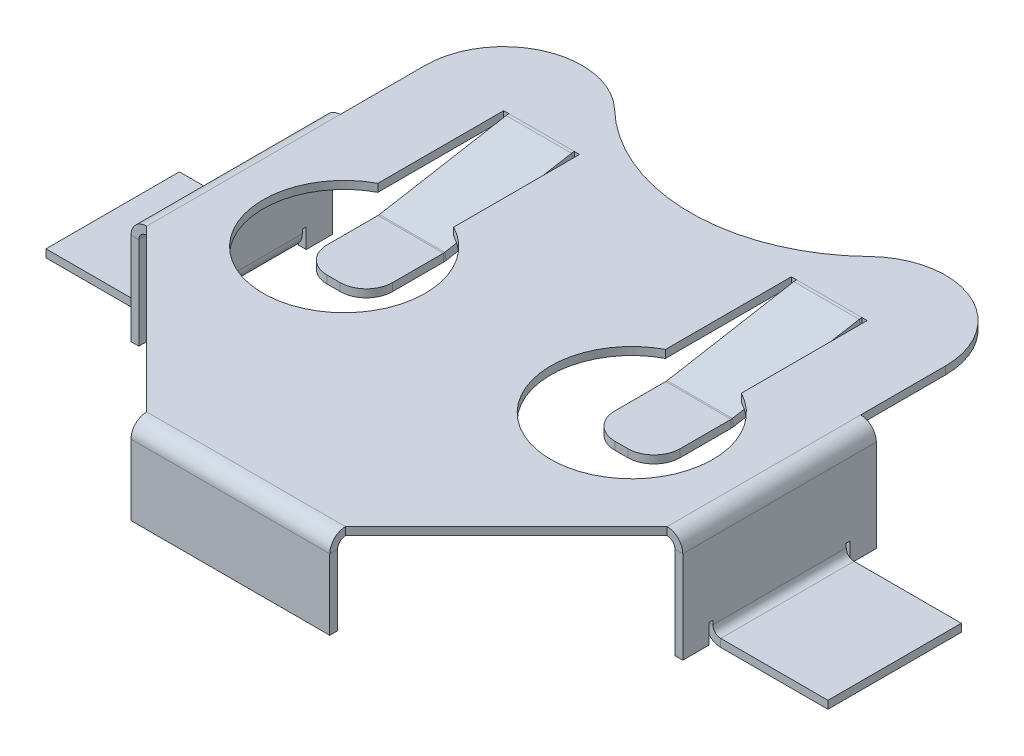
from build123d import *

# Parameters (mm, degrees)
BASE_FLANGE1_DEPTH              = 0.3
EDGE_FLANGE2_DEPTH              = 7.6
EDGE_FLANGE3_DEPTH              = 7.4
EDGE_FLANGE3_BEND_DEPTH         = 7.4
EDGE_FLANGE9_STRIP_W            = 1.8
EDGE_FLANGE9_STRIP_H            = 0.3
EDGE_FLANGE9_STRIP_CUT_DEPTH    = 5.1
EDGE_FLANGE9_RELIEF_W           = 1.95
EDGE_FLANGE9_RELIEF_H           = 0.15
EDGE_FLANGE9_RELIEF_CUT_DEPTH   = 0.3
EDGE_FLANGE9_STRIP_2_W          = 1.8
EDGE_FLANGE9_STRIP_2_H          = 0.3
EDGE_FLANGE9_STRIP_CUT_2_DEPTH  = 5.1
EDGE_FLANGE9_RELIEF_2_W         = 1.95
EDGE_FLANGE9_RELIEF_2_H         = 0.15
EDGE_FLANGE9_RELIEF_CUT_2_DEPTH = 0.3
EDGE_FLANGE9_DEPTH              = 5.1
EDGE_FLANGE9_BEND_DEPTH         = 5.1
SKETCH164_R                     = 3.1
CUT_EXTRUDE1_DEPTH              = 10
CUT_EXTRUDE2_DEPTH              = 26.150701614
CUT_EXTRUDE2_DEPTH_BACK         = 26.150701614
SKETCH228_W                     = 2.9
SKETCH228_H                     = 7.24828594
EDGE_FLANGE10_DEPTH             = 2.5
EDGE_FLANGE10_BEND_DEPTH        = 2.5
EDGE_FLANGE11_STRIP_CUT_DEPTH   = 2.5
EDGE_FLANGE11_STRIP_CUT_2_DEPTH = 2.5
EDGE_FLANGE11_DEPTH             = 2.5
EDGE_FLANGE11_BEND_DEPTH        = 2.5
BREAK_CORNER1_START             = -1.168240888
BREAK_CORNER1_DEPTH             = 0.3


# Read off the part's stored shape, not the designer's step: Break-Corner1
# Sheet-metal steps are written as plain solids
with BuildPart() as part:
    # Sketch1 → Base-Flange1 (new body)
    with BuildSketch(Plane(origin=(0, 0, 0), x_dir=(1, 0, 0), z_dir=(0, 1, 0))):
        with BuildLine():
            Line((-3.8, 0), (3.8, 0))
            Line((3.8, 0), (9.95, 6.15))
            Line((9.95, 6.15), (9.95, 16.8))
            ThreePointArc((9.95, 16.8), (8.121537451, 19.561792896), (4.865, 18.957029207))
            ThreePointArc((4.865, 18.957029207), (0, 16.990097357), (-4.865, 18.957029207))
            ThreePointArc((-4.865, 18.957029207), (-8.121537451, 19.561792896), (-9.95, 16.8))
            Line((-9.95, 16.8), (-9.95, 6.15))
            Line((-9.95, 6.15), (-3.8, 0))
        make_face()
    extrude(amount=-BASE_FLANGE1_DEPTH)

    # Edge-Flange2 section (across the edge) → Edge-Flange2 (add)
    with BuildSketch(Plane(origin=(3.8, -0.3, 0.3), x_dir=(0, 0, -1), z_dir=(-1, 0, 0))):
        with BuildLine():
            Line((-0.3, 0.3), (-0.3, 3))
            Line((-0.3, 3), (0, 3))
            Line((0, 3), (0, 0.3))
            ThreePointArc((0, 0.3), (0.087867966, 0.087867966), (0.3, 0))
            Line((0.3, 0), (0.3, -0.3))
            ThreePointArc((0.3, -0.3), (-0.124264069, -0.124264069), (-0.3, 0.3))
        make_face()
    extrude(amount=EDGE_FLANGE2_DEPTH)

    # Edge-Flange3 section (across the edge) → Edge-Flange3 (add)
    with BuildSketch(Plane(origin=(10.25, -0.3, -13.55), x_dir=(-1, 0, 0), z_dir=(0, 0, 1))):
        with BuildLine():
            Line((-0.3, 0.3), (-0.3, 3.8249596))
            Line((-0.3, 3.8249596), (0, 3.8249596))
            Line((0, 3.8249596), (0, 0.3))
            ThreePointArc((0, 0.3), (0.087867966, 0.087867966), (0.3, 0))
            Line((0.3, 0), (0.3, -0.3))
            ThreePointArc((0.3, -0.3), (-0.124264069, -0.124264069), (-0.3, 0.3))
        make_face()
    extrude(amount=EDGE_FLANGE3_DEPTH)

    # Edge-Flange3 section 2 (across the edge) → Edge-Flange3 bend (add)
    with BuildSketch(Plane(origin=(-10.25, -0.3, -6.15), x_dir=(1, 0, 0), z_dir=(0, 0, -1))):
        with BuildLine():
            Line((-0.3, 0.3), (-0.3, 3.8249596))
            Line((-0.3, 3.8249596), (0, 3.8249596))
            Line((0, 3.8249596), (0, 0.3))
            ThreePointArc((0, 0.3), (0.087867966, 0.087867966), (0.3, 0))
            Line((0.3, 0), (0.3, -0.3))
            ThreePointArc((0.3, -0.3), (-0.124264069, -0.124264069), (-0.3, 0.3))
        make_face()
    extrude(amount=EDGE_FLANGE3_BEND_DEPTH)

    # Edge-Flange9 strip (across the edge) → Edge-Flange9 strip cut (cut)
    with BuildSketch(Plane(origin=(-10.55, -4.1249596, -12.4), x_dir=(0, 1, 0), z_dir=(0, 0, 1))):
        with Locations((-0.3, -0.15)):
            Rectangle(EDGE_FLANGE9_STRIP_W, EDGE_FLANGE9_STRIP_H)
    extrude(amount=EDGE_FLANGE9_STRIP_CUT_DEPTH, mode=Mode.SUBTRACT)

    # Edge-Flange9 relief (on the sheet) → Edge-Flange9 relief cut (cut)
    with BuildSketch(Plane(origin=(-10.55, -3.5249596, -12.4), x_dir=(0, 1, 0), z_dir=(-1, 0, 0))):
        with Locations((-0.825, 0.075)):
            Rectangle(EDGE_FLANGE9_RELIEF_W, EDGE_FLANGE9_RELIEF_H)
        with Locations((-0.825, -5.175)):
            Rectangle(EDGE_FLANGE9_RELIEF_W, EDGE_FLANGE9_RELIEF_H)
    extrude(amount=-EDGE_FLANGE9_RELIEF_CUT_DEPTH, mode=Mode.SUBTRACT)

    # Edge-Flange9 strip 2 (across the edge) → Edge-Flange9 strip cut 2 (cut)
    with BuildSketch(Plane(origin=(10.55, -4.1249596, -7.3), x_dir=(0, 1, 0), z_dir=(0, 0, -1))):
        with Locations((-0.3, -0.15)):
            Rectangle(EDGE_FLANGE9_STRIP_2_W, EDGE_FLANGE9_STRIP_2_H)
    extrude(amount=EDGE_FLANGE9_STRIP_CUT_2_DEPTH, mode=Mode.SUBTRACT)

    # Edge-Flange9 relief 2 (on the sheet) → Edge-Flange9 relief cut 2 (cut)
    with BuildSketch(Plane(origin=(10.55, -3.5249596, -7.3), x_dir=(0, 1, 0), z_dir=(1, 0, 0))):
        with Locations((-0.825, 0.075)):
            Rectangle(EDGE_FLANGE9_RELIEF_2_W, EDGE_FLANGE9_RELIEF_2_H)
        with Locations((-0.825, -5.175)):
            Rectangle(EDGE_FLANGE9_RELIEF_2_W, EDGE_FLANGE9_RELIEF_2_H)
    extrude(amount=-EDGE_FLANGE9_RELIEF_CUT_2_DEPTH, mode=Mode.SUBTRACT)

    # Edge-Flange9 section (across the edge) → Edge-Flange9 (add)
    with BuildSketch(Plane(origin=(-10.55, -4.1249596, -12.4), x_dir=(0, 1, 0), z_dir=(0, 0, 1))):
        with BuildLine():
            Line((0, 0.3), (0, 4.4))
            Line((0, 4.4), (0.3, 4.4))
            Line((0.3, 4.4), (0.3, 0.3))
            ThreePointArc((0.3, 0.3), (0.387867966, 0.087867966), (0.6, 0))
            Line((0.6, 0), (0.6, -0.3))
            ThreePointArc((0.6, -0.3), (0.175735931, -0.124264069), (0, 0.3))
        make_face()
    extrude(amount=EDGE_FLANGE9_DEPTH)

    # Edge-Flange9 section 2 (across the edge) → Edge-Flange9 bend (add)
    with BuildSketch(Plane(origin=(10.55, -4.1249596, -7.3), x_dir=(0, 1, 0), z_dir=(0, 0, -1))):
        with BuildLine():
            Line((0, 0.3), (0, 4.4))
            Line((0, 4.4), (0.3, 4.4))
            Line((0.3, 4.4), (0.3, 0.3))
            ThreePointArc((0.3, 0.3), (0.387867966, 0.087867966), (0.6, 0))
            Line((0.6, 0), (0.6, -0.3))
            ThreePointArc((0.6, -0.3), (0.175735931, -0.124264069), (0, 0.3))
        make_face()
    extrude(amount=EDGE_FLANGE9_BEND_DEPTH)

    # Sketch164 → Cut-Extrude1 (cut)
    with BuildSketch(Plane(origin=(0, 0, 0), x_dir=(1, 0, 0), z_dir=(0, 1, 0))):
        with Locations(Location((-5.5, 9.25, 0), (0, 0, 270))):
            Circle(SKETCH164_R)
        with Locations(Location((5.5, 9.25, 0), (0, 0, 270))):
            Circle(SKETCH164_R)
    extrude(amount=-CUT_EXTRUDE1_DEPTH, mode=Mode.SUBTRACT)

    # Sketch228 → Cut-Extrude2 (cut, two sides: drawn at the far end of the back side and taken through both)
    with BuildSketch(Plane(origin=(0, 0, 0), x_dir=(1, 0, 0), z_dir=(0, 1, 0)).offset(-CUT_EXTRUDE2_DEPTH_BACK)):
        with Locations((-5.5, 13.17585703)):
            Rectangle(SKETCH228_W, SKETCH228_H)
        with Locations((5.5, 13.17585703)):
            Rectangle(SKETCH228_W, SKETCH228_H)
    extrude(amount=CUT_EXTRUDE2_DEPTH + CUT_EXTRUDE2_DEPTH_BACK, mode=Mode.SUBTRACT)

    # Edge-Flange10 section (across the edge) → Edge-Flange10 (add)
    with BuildSketch(Plane(origin=(-4.25, -0.3, -16.773753401), x_dir=(0, -0.9848077530122092, -0.1736481776669237), z_dir=(-1, 0, 0))):
        with BuildLine():
            Line((-0.3, 0.026246599), (-0.3, 4.973753401))
            Line((-0.3, 4.973753401), (0, 4.973753401))
            Line((0, 4.973753401), (0, 0.026246599))
            ThreePointArc((0, 0.026246599), (0.001141591, 9.9876e-05), (0.004557674, -0.025847854))
            Line((0.004557674, -0.025847854), (-0.290884652, -0.077942308))
            ThreePointArc((-0.290884652, -0.077942308), (-0.297716819, -0.026046847), (-0.3, 0.026246599))
        make_face()
    extrude(amount=EDGE_FLANGE10_DEPTH)

    # Edge-Flange10 section 2 (across the edge) → Edge-Flange10 bend (add)
    with BuildSketch(Plane(origin=(6.75, -0.3, -16.773753401), x_dir=(0, -0.9848077530122092, -0.1736481776669237), z_dir=(-1, 0, 0))):
        with BuildLine():
            Line((-0.3, 0.026246599), (-0.3, 4.973753401))
            Line((-0.3, 4.973753401), (0, 4.973753401))
            Line((0, 4.973753401), (0, 0.026246599))
            ThreePointArc((0, 0.026246599), (0.001141591, 9.9876e-05), (0.004557674, -0.025847854))
            Line((0.004557674, -0.025847854), (-0.290884652, -0.077942308))
            ThreePointArc((-0.290884652, -0.077942308), (-0.297716819, -0.026046847), (-0.3, 0.026246599))
        make_face()
    extrude(amount=EDGE_FLANGE10_BEND_DEPTH)

    # Edge-Flange11 strip (across the edge) → Edge-Flange11 strip cut (cut)
    with BuildSketch(Plane(origin=(-6.75, -0.868240888, -11.823468037), x_dir=(0, 1, 0), z_dir=(1, 0, 0))):
        Polygon((-0.603451372, 1.694711648), (-0.290884652, -0.077942308), (0.004557674, -0.025847854), (-0.308009046, 1.746806101), align=None)
    extrude(amount=EDGE_FLANGE11_STRIP_CUT_DEPTH, mode=Mode.SUBTRACT)

    # Edge-Flange11 strip 2 (across the edge) → Edge-Flange11 strip cut 2 (cut)
    with BuildSketch(Plane(origin=(4.25, -0.868240888, -11.823468037), x_dir=(0, 1, 0), z_dir=(1, 0, 0))):
        Polygon((-0.603451372, 1.694711648), (-0.290884652, -0.077942308), (0.004557674, -0.025847854), (-0.308009046, 1.746806101), align=None)
    extrude(amount=EDGE_FLANGE11_STRIP_CUT_2_DEPTH, mode=Mode.SUBTRACT)

    # Edge-Flange11 section (across the edge) → Edge-Flange11 (add)
    with BuildSketch(Plane(origin=(-6.75, -0.868240888, -11.823468037), x_dir=(0, 1, 0), z_dir=(1, 0, 0))):
        with BuildLine():
            Line((-0.3, 0.026246599), (-0.3, 2.973753401))
            Line((-0.3, 2.973753401), (0, 2.973753401))
            Line((0, 2.973753401), (0, 0.026246599))
            ThreePointArc((0, 0.026246599), (0.001141591, 9.9876e-05), (0.004557674, -0.025847854))
            Line((0.004557674, -0.025847854), (-0.290884652, -0.077942308))
            ThreePointArc((-0.290884652, -0.077942308), (-0.297716819, -0.026046847), (-0.3, 0.026246599))
        make_face()
    extrude(amount=EDGE_FLANGE11_DEPTH)

    # Edge-Flange11 section 2 (across the edge) → Edge-Flange11 bend (add)
    with BuildSketch(Plane(origin=(4.25, -0.868240888, -11.823468037), x_dir=(0, 1, 0), z_dir=(1, 0, 0))):
        with BuildLine():
            Line((-0.3, 0.026246599), (-0.3, 2.973753401))
            Line((-0.3, 2.973753401), (0, 2.973753401))
            Line((0, 2.973753401), (0, 0.026246599))
            ThreePointArc((0, 0.026246599), (0.001141591, 9.9876e-05), (0.004557674, -0.025847854))
            Line((0.004557674, -0.025847854), (-0.290884652, -0.077942308))
            ThreePointArc((-0.290884652, -0.077942308), (-0.297716819, -0.026046847), (-0.3, 0.026246599))
        make_face()
    extrude(amount=EDGE_FLANGE11_BEND_DEPTH)

    # Break-Corner1 outline → Break-Corner1 (cut)
    with BuildSketch(Plane(origin=(0, 0, 0), x_dir=(1, 0, 0), z_dir=(0, 1, 0)).offset(BREAK_CORNER1_START)):
        with BuildLine():
            ThreePointArc((6.75, 9.849714636), (6.457106781, 9.142607855), (5.75, 8.849714636))
            Line((5.75, 8.849714636), (6.75, 8.849714636))
            Line((6.75, 8.849714636), (6.75, 9.849714636))
        make_face()
        with BuildLine():
            Line((4.25, 8.849714636), (5.25, 8.849714636))
            ThreePointArc((5.25, 8.849714636), (4.542893219, 9.142607855), (4.25, 9.849714636))
            Line((4.25, 9.849714636), (4.25, 8.849714636))
        make_face()
        with BuildLine():
            ThreePointArc((-4.25, 9.849714636), (-4.542893219, 9.142607855), (-5.25, 8.849714636))
            Line((-5.25, 8.849714636), (-4.25, 8.849714636))
            Line((-4.25, 8.849714636), (-4.25, 9.849714636))
        make_face()
        with BuildLine():
            ThreePointArc((-5.75, 8.849714636), (-6.457106781, 9.142607855), (-6.75, 9.849714636))
            Line((-6.75, 9.849714636), (-6.75, 8.849714636))
            Line((-6.75, 8.849714636), (-5.75, 8.849714636))
        make_face()
    extrude(amount=BREAK_CORNER1_DEPTH, mode=Mode.SUBTRACT)


solid = part.part
